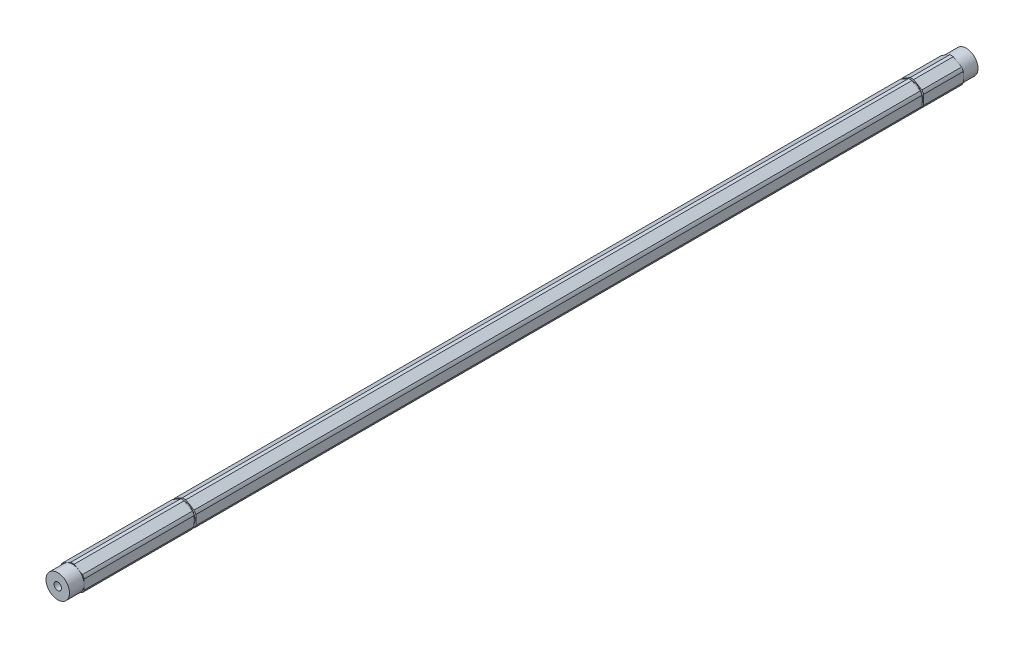
from build123d import *

# Parameters (mm, degrees)
SKETCH1_R           = 2.000000064
BOSS_EXTRUDE1_DEPTH = 237.47984
SKETCH3_R           = 6.35
SKETCH3_R_2         = 2.000000064
BOSS_EXTRUDE3_DEPTH = 7.9375
SKETCH5_W           = 0.889
SKETCH5_H           = 1.0033


with BuildPart() as part:
    # Sketch1 → Boss-Extrude1 (new, symmetric)
    with BuildSketch(Plane.XY):
        with BuildLine():
            ThreePointArc((0.93173274, 6.79441227), (0, 6.858), (-0.93173274, 6.79441227))
            Line((-0.93173274, 6.79441227), (-5.41826726, 4.204110358))
            ThreePointArc((-5.41826726, 4.204110358), (-5.939202219, 3.429), (-6.35, 2.590301913))
            Line((-6.35, 2.590301913), (-6.35, -2.590301913))
            ThreePointArc((-6.35, -2.590301913), (-5.939202219, -3.429), (-5.41826726, -4.204110358))
            Line((-5.41826726, -4.204110358), (-0.93173274, -6.79441227))
            ThreePointArc((-0.93173274, -6.79441227), (0, -6.858), (0.93173274, -6.79441227))
            Line((0.93173274, -6.79441227), (5.41826726, -4.204110358))
            ThreePointArc((5.41826726, -4.204110358), (5.939202219, -3.429), (6.35, -2.590301913))
            Line((6.35, -2.590301913), (6.35, 2.590301913))
            ThreePointArc((6.35, 2.590301913), (5.939202219, 3.429), (5.41826726, 4.204110358))
            Line((5.41826726, 4.204110358), (0.93173274, 6.79441227))
        make_face()
        Circle(SKETCH1_R, mode=Mode.SUBTRACT)
    extrude(amount=BOSS_EXTRUDE1_DEPTH, both=True)

    # Sketch3 → Boss-Extrude3 (add)
    with BuildSketch(Plane.XY.offset(237.47984)):
        Circle(SKETCH3_R)
        Circle(SKETCH3_R_2, mode=Mode.SUBTRACT)
    boss_extrude3 = extrude(amount=BOSS_EXTRUDE3_DEPTH)

    # Mirror1: Boss-Extrude3 across plane
    add(boss_extrude3.mirror(Plane.XY))

    # Sketch5 → Cut-Revolve1 (revolve, cut)
    with BuildSketch(Plane(origin=(0, 0, 0), x_dir=(0, 0, -1), z_dir=(1, 0, 0))):
        with Locations((-177.59934, 6.35635)):
            Rectangle(SKETCH5_W, SKETCH5_H)
        with Locations((215.60282, 6.35635)):
            Rectangle(SKETCH5_W, SKETCH5_H)
    revolve(axis=Axis((0, 0, 0), (0, 0, -1)), mode=Mode.SUBTRACT)


solid = part.part
